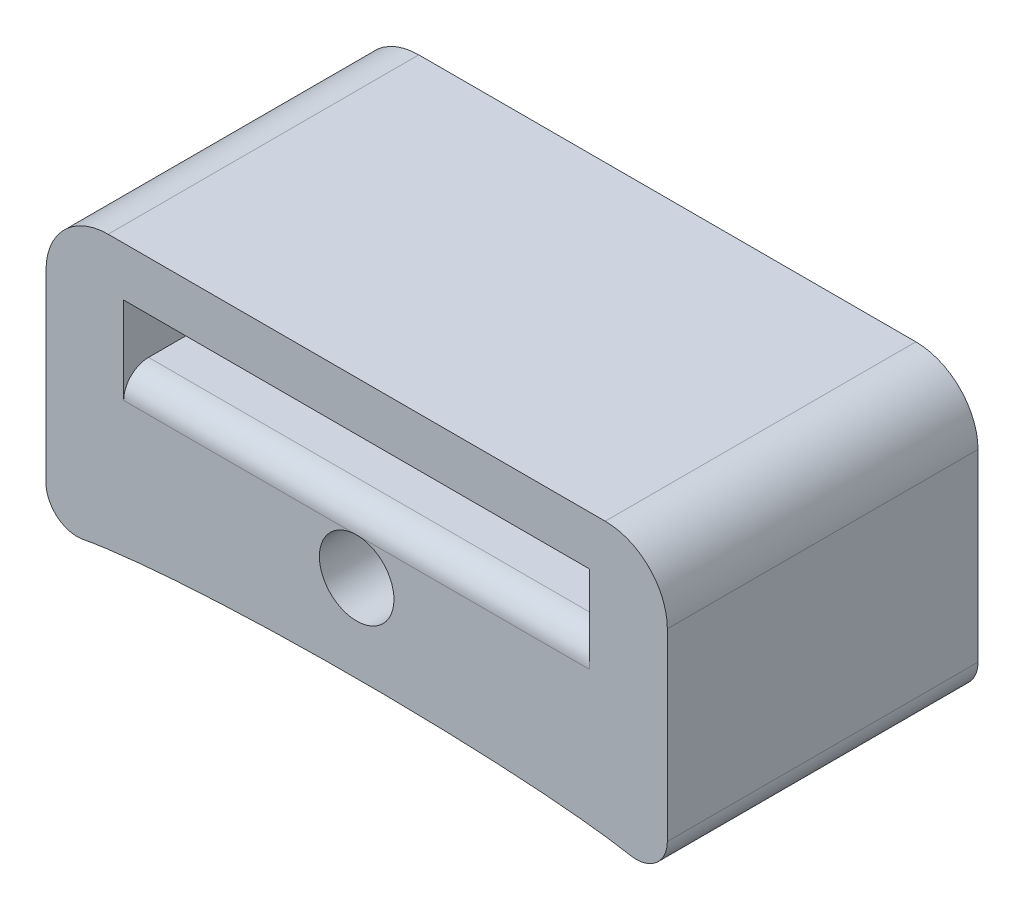
from build123d import *

# Parameters (mm, degrees)
SKETCH1_W           = 10
SKETCH1_H           = 5
BOSS_EXTRUDE1_DEPTH = 5
SKETCH2_W           = 10
SKETCH2_H           = 0.30799953
SKETCH2_W_2         = 7.5
SKETCH2_H_2         = 1
SKETCH2_R           = 0.6
CUT_EXTRUDE1_DEPTH  = 10
FILLET1_START       = 36
FILLET1_DEPTH       = 7
FILLET2_R           = 1
FILLET3_R           = 0.4


with BuildPart() as part:
    # Sketch1 → Boss-Extrude1 (new body)
    with BuildSketch(Plane(origin=(0, 0, 0), x_dir=(1, 0, 0), z_dir=(0, 1, 0))):
        with Locations((-136.503596575, -39.342461353)):
            Rectangle(SKETCH1_W, SKETCH1_H)
    extrude(amount=BOSS_EXTRUDE1_DEPTH)

    # Sketch2 → Cut-Extrude1 (cut)
    with BuildSketch(Plane.XY.offset(41.842461353)):
        with Locations((-136.503596575, 4.846000235)):
            Rectangle(SKETCH2_W, SKETCH2_H)
        with Locations((-136.503596575, 3.4)):
            Rectangle(SKETCH2_W_2, SKETCH2_H_2)
        with Locations((-136.503596575, 1.9)):
            Circle(SKETCH2_R)
        with BuildLine():
            add(Edge.make_bspline(
                [(-131.503596575, 0), (-131.503596575, 0.5), (-136.503596575, 0.5)],
                knots=[0, 0, 0, 1.570796327, 1.570796327, 1.570796327], degree=2, weights=[1, 0.707106781, 1]))
            add(Edge.make_bspline(
                [(-136.503596575, 0.5), (-148.574664386, 0.5), (-140.03913048, -0.353553391), (-131.503596575, -1.207106781), (-131.503596575, 0)],
                knots=[1.570796327, 1.570796327, 1.570796327, 3.926990817, 3.926990817, 6.283185307, 6.283185307, 6.283185307], degree=2, weights=[1, 0.382683432, 1, 0.382683432, 1]))
        make_face()
    extrude(amount=-CUT_EXTRUDE1_DEPTH, mode=Mode.SUBTRACT)

    # Fillet1: read off the stored shape, not the designer's step
    # Fillet1 outline → Fillet1 (cut)
    with BuildSketch(Plane.XY.offset(FILLET1_START)):
        with BuildLine():
            ThreePointArc((-131.503596575, 0.727461803), (-131.684151383, 0.342812912), (-132.095415653, 0.235964848))
            add(Edge.make_bspline(
                [(-131.503596575, 0), (-131.503596575, 0.125404077), (-132.095415653, 0.235964848)],
                knots=[0, 0, 0, 0.504721097, 0.504721097, 0.504721097], degree=2, weights=[1, 0.905888889, 0.872256483]))
            Line((-131.503596575, 0), (-131.503596575, 0.727461803))
        make_face()
        with BuildLine():
            ThreePointArc((-140.911777496, 0.235964848), (-141.323041766, 0.342812912), (-141.503596575, 0.727461803))
            Line((-141.503596575, 0.727461803), (-141.503596575, 0))
            add(Edge.make_bspline(
                [(-140.911777496, 0.235964848), (-141.503596575, 0.125404077), (-141.503596575, 0)],
                knots=[2.636871556, 2.636871556, 2.636871556, 3.141592654, 3.141592654, 3.141592654], degree=2, weights=[0.872256483, 0.905888889, 1]))
        make_face()
    extrude(amount=FILLET1_DEPTH, mode=Mode.SUBTRACT)

    # Fillet2
    fillet2_edges = [part.edges().sort_by_distance(p)[0] for p in [
        (-131.503596575, 4.69200047, 39.342461353),
        (-141.503596575, 4.69200047, 39.342461353),
    ]]
    fillet(fillet2_edges, radius=FILLET2_R)

    # Fillet3
    fillet3_edges = [part.edges().sort_by_distance(p)[0] for p in [
        (-136.503596575, 2.9, 36.842461353),
        (-136.503596575, 2.9, 41.842461353),
    ]]
    fillet(fillet3_edges, radius=FILLET3_R - 0.0001)  # a hair under: the kernel refuses the full size


solid = part.part
